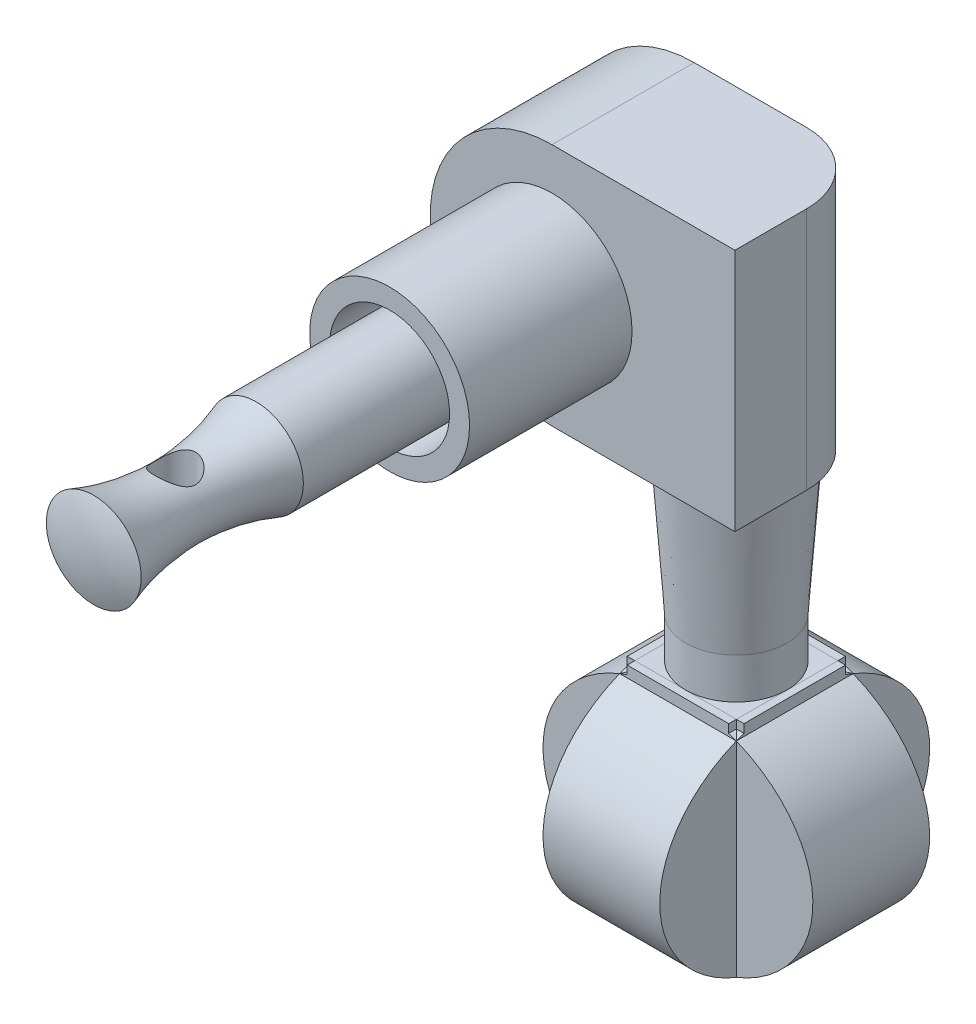
from build123d import *

# Parameters (mm, degrees)
MOVE_START             = 1.86
MOVE_FACE1_DEPTH       = 5.08
MOVE_FACE1_2_OUTLINE_R = 5.08
MOVE_FACE1_2_DEPTH     = 19.05
MOVE_FACE1_3_OUTLINE_R = 5.08
MOVE_FACE1_3_DEPTH     = 8.89
MOVE_START_2           = 19.05
MOVE_FACE1_4_OUTLINE_R = 2.95
MOVE_FACE1_4_DEPTH     = 19.05
MOVE_START_3           = 6.731
MOVE_FACE1_5_OUTLINE_R = 1.125
MOVE_FACE1_5_DEPTH     = 2.159
MOVE_START_4           = -7.62
MOVE_FACE1_6_OUTLINE_R = 1.27
MOVE_FACE1_6_DEPTH     = 15.24
MOVE_START_5           = -19.05
MOVE_FACE1_7_OUTLINE_R = 3.81
MOVE_FACE1_7_DEPTH     = 11.43
CUT_EXTRUDE2_START     = -8.3
SKETCH4_R              = 3.75
SKETCH4_R_2            = 2.95
CUT_EXTRUDE2_DEPTH     = 8.3
MOVE_FACE2_BY          = 0.08
SKETCH6_W              = 22.532040778
SKETCH6_H              = 17.162622236
CUT_EXTRUDE3_DEPTH     = 16.1
SKETCH7_W              = 16.875
SKETCH7_H              = 7.3
BOSS_EXTRUDE1_DEPTH    = 14.2
CUT_EXTRUDE4_DEPTH     = 14.2
MOVE_START_6           = 3.38
MOVE_FACE5_DEPTH       = 7.3
CUT_EXTRUDE5_REACH     = 50.258


with BuildPart() as part:
    # Move Face1: read off the stored shape, not the designer's step
    # Move Face1 outline → Move Face1 (new body)
    with BuildSketch(Plane.XY.offset(MOVE_START)):
        with BuildLine():
            ThreePointArc((-3.511, -31.99383827), (7.03, -34.29), (17.571, -31.99383827))
            Line((17.571, -31.99383827), (17.571, -22.753852444))
            Line((17.571, -22.753852444), (11.389315764, -19.05))
            Line((11.389315764, -19.05), (2.670684236, -19.05))
            Line((2.670684236, -19.05), (-3.511, -22.753852444))
            Line((-3.511, -22.753852444), (-3.511, -31.99383827))
        make_face()
        with BuildLine():
            Line((0, -7.62), (11.43, -7.62))
            Line((11.43, -7.62), (11.43, 7.62))
            Line((11.43, 7.62), (0, 7.62))
            ThreePointArc((0, 7.62), (-7.62, 0), (0, -7.62))
        make_face()
    extrude(amount=MOVE_FACE1_DEPTH)

    # Move Face1 2 outline → Move Face1 2 (add)
    with BuildSketch(Plane.XY):
        Circle(MOVE_FACE1_2_OUTLINE_R)
    extrude(amount=MOVE_FACE1_2_DEPTH)

    # Move Face1 3 outline → Move Face1 3 (add)
    with BuildSketch(Plane.XY):
        with BuildLine():
            ThreePointArc((0, 7.62), (-7.62, 0), (0, -7.62))
            Line((0, -7.62), (11.43, -7.62))
            Line((11.43, -7.62), (11.43, 7.62))
            Line((11.43, 7.62), (0, 7.62))
        make_face()
        Circle(MOVE_FACE1_3_OUTLINE_R, mode=Mode.SUBTRACT)
    extrude(amount=MOVE_FACE1_3_DEPTH)

    # Move Face1 4 outline → Move Face1 4 (add)
    with BuildSketch(Plane.XY.offset(MOVE_START_2)):
        Circle(MOVE_FACE1_4_OUTLINE_R)
    extrude(amount=MOVE_FACE1_4_DEPTH)

    # Move Face1 5 outline → Move Face1 5 (add)
    with BuildSketch(Plane.XY.offset(MOVE_START_3)):
        with BuildLine():
            Line((-10.24004056, 5.820733333), (-7.414650266, 1.75708891))
            ThreePointArc((-7.414650266, 1.75708891), (-5.388153673, 5.388153673), (-1.75708891, 7.414650266))
            Line((-1.75708891, 7.414650266), (-5.820733333, 10.24004056))
            ThreePointArc((-5.820733333, 10.24004056), (-9.878281733, 9.878281733), (-10.24004056, 5.820733333))
        make_face()
        with Locations((-7.633217703, 7.633217703)):
            Circle(MOVE_FACE1_5_OUTLINE_R, mode=Mode.SUBTRACT)
    extrude(amount=MOVE_FACE1_5_DEPTH)

    # Move Face1 6 outline → Move Face1 6 (cut)
    with BuildSketch(Plane(origin=(0, 0, 0), x_dir=(1, 0, 0), z_dir=(0, 1, 0)).offset(MOVE_START_4)):
        with BuildLine():
            ThreePointArc((7.03, 0), (10.141269837, -1.288730163), (11.43, -4.4))
            Line((11.43, -4.4), (11.43, 0))
            Line((11.43, 0), (7.03, 0))
        make_face()
        with Locations((0, -32.4485)):
            Circle(MOVE_FACE1_6_OUTLINE_R)
    extrude(amount=MOVE_FACE1_6_DEPTH, mode=Mode.SUBTRACT)

    # Move Face1 7 outline → Move Face1 7 (add)
    with BuildSketch(Plane(origin=(0, 0, 0), x_dir=(1, 0, 0), z_dir=(0, 1, 0)).offset(MOVE_START_5)):
        with Locations((7.03, -4.4)):
            Circle(MOVE_FACE1_7_OUTLINE_R)
    extrude(amount=MOVE_FACE1_7_DEPTH)

    # Move Face1 8 outline → Move Face1 8 (revolve, cut)
    with BuildSketch(Plane.XZ):
        with BuildLine():
            ThreePointArc((0, 38.1), (1.499969695, 37.962580669), (2.95, 37.554897859))
            Line((2.95, 37.554897859), (2.95, 38.1))
            Line((2.95, 38.1), (0, 38.1))
        make_face()
        with BuildLine():
            Line((2.95, 27.392283801), (2.95, 37.504716198))
            ThreePointArc((2.95, 37.504716198), (2.061, 32.448499999), (2.95, 27.392283801))
        make_face()
    revolve(axis=Axis((0, 0, 0), (0, 0, 1)), mode=Mode.SUBTRACT)

    # Move Face1 9 outline → Move Face1 9 (revolve)
    with BuildSketch(Plane.XZ):
        with BuildLine():
            ThreePointArc((2.95, 37.504716198), (2.958008721, 37.526732793), (2.96605223, 37.548736702))
            ThreePointArc((2.96605223, 37.548736702), (2.958027723, 37.551821458), (2.95, 37.554897859))
            Line((2.95, 37.554897859), (2.95, 37.504716198))
        make_face()
    revolve(axis=Axis((0, 0, 0), (0, 0, 1)))

    # Sketch4 → Cut-Extrude2 (cut)
    with BuildSketch(Plane.XY.offset(19.05).offset(CUT_EXTRUDE2_START)):
        Circle(SKETCH4_R)
        Circle(SKETCH4_R_2, mode=Mode.SUBTRACT)
    extrude(amount=CUT_EXTRUDE2_DEPTH, mode=Mode.SUBTRACT)

    # Sketch5 → Cut-Revolve1 (revolve, cut)
    with BuildSketch(Plane(origin=(0, 0, 4.4), x_dir=(-1, 0, 0), z_dir=(0, 0, -1))):
        Polygon((-3.22, -7.62), (-3.22, -19.05), (-3.855, -19.05), (-3.855, -16.51), align=None)
    revolve(axis=Axis((7.03, -7.62, 4.4), (0, -1, 0)), mode=Mode.SUBTRACT)

    # Move Face2: a curved face moved inward by 0.08
    add(Solid.thicken(part.faces().sort_by_distance((-5.08, 0, 13.97))[0], -MOVE_FACE2_BY), mode=Mode.SUBTRACT)

    # Sketch6 → Cut-Extrude3 (cut)
    with BuildSketch(Plane.XY):
        with Locations((7.03, -27.631311118)):
            Rectangle(SKETCH6_W, SKETCH6_H)
    extrude(amount=CUT_EXTRUDE3_DEPTH, mode=Mode.SUBTRACT)

    # Sketch7 → Boss-Extrude1 (add)
    with BuildSketch(Plane.XZ.offset(19.05)):
        with Locations((7.03, 4.4)):
            Rectangle(SKETCH7_W, SKETCH7_H)
    extrude(amount=BOSS_EXTRUDE1_DEPTH)

    # Sketch8 → Cut-Extrude4 (cut)
    with BuildSketch(Plane(origin=(0, 0, 0.75), x_dir=(-1, 0, 0), z_dir=(0, 0, -1))):
        with BuildLine():
            Line((-10.205, -19.571854416), (-10.205, -19.05))
            Line((-10.205, -19.05), (-15.4675, -19.05))
            Line((-15.4675, -19.05), (-15.4675, -26.15))
            add(Edge.make_bspline(
                [(-10.205, -19.571854416), (-15.4675, -21.370400141), (-15.4675, -26.15)],
                knots=[1.956591838, 1.956591838, 1.956591838, 3.141592654, 3.141592654, 3.141592654], degree=2, weights=[1, 0.829546954, 1]))
        make_face()
        with BuildLine():
            Line((1.4075, -19.05), (-3.855, -19.05))
            Line((-3.855, -19.05), (-3.855, -19.571854416))
            add(Edge.make_bspline(
                [(1.4075, -26.15), (1.4075, -21.370400141), (-3.855, -19.571854416)],
                knots=[0, 0, 0, 1.185000816, 1.185000816, 1.185000816], degree=2, weights=[1, 0.829546954, 1]))
            Line((1.4075, -26.15), (1.4075, -19.05))
        make_face()
        with BuildLine():
            add(Edge.make_bspline(
                [(-15.4675, -26.15), (-15.4675, -33.25), (-7.03, -33.25)],
                knots=[3.141592654, 3.141592654, 3.141592654, 4.71238898, 4.71238898, 4.71238898], degree=2, weights=[1, 0.707106781, 1]))
            Line((-15.4675, -26.15), (-15.4675, -33.25))
            Line((-15.4675, -33.25), (-7.03, -33.25))
        make_face()
        with BuildLine():
            Line((1.4075, -33.25), (1.4075, -26.15))
            add(Edge.make_bspline(
                [(-7.03, -33.25), (1.4075, -33.25), (1.4075, -26.15)],
                knots=[4.71238898, 4.71238898, 4.71238898, 6.283185307, 6.283185307, 6.283185307], degree=2, weights=[1, 0.707106781, 1]))
            Line((-7.03, -33.25), (1.4075, -33.25))
        make_face()
    extrude(amount=-CUT_EXTRUDE4_DEPTH, mode=Mode.SUBTRACT)

    # Move Face5: read off the stored shape, not the designer's step
    # Move Face5 outline → Move Face5 (add)
    with BuildSketch(Plane.YZ.offset(MOVE_START_6)):
        with BuildLine():
            Line((-32.551285538, 0.75), (-19.748714462, 0.75))
            add(Edge.make_bspline(
                [(-19.748714462, 0.75), (-19.654129969, 0.984263783), (-19.571854416, 1.225)],
                knots=[1.123429947, 1.123429947, 1.123429947, 1.185000816, 1.185000816, 1.185000816], degree=2, weights=[1, 0.999526166, 1]))
            Line((-19.571854416, 1.225), (-19.05, 1.225))
            Line((-19.05, 1.225), (-19.05, 7.575))
            Line((-19.05, 7.575), (-19.571854416, 7.575))
            add(Edge.make_bspline(
                [(-19.571854416, 7.575), (-19.654129969, 7.815736217), (-19.748714462, 8.05)],
                knots=[1.956591838, 1.956591838, 1.956591838, 2.018162706, 2.018162706, 2.018162706], degree=2, weights=[1, 0.999526166, 1]))
            Line((-19.748714462, 8.05), (-32.551285538, 8.05))
            add(Edge.make_bspline(
                [(-32.551285538, 8.05), (-34.02498069, 4.4), (-32.551285538, 0.75)],
                knots=[4.265022601, 4.265022601, 4.265022601, 5.15975536, 5.15975536, 5.15975536], degree=2, weights=[1, 0.901589512, 1]))
        make_face()
        with BuildLine():
            add(Edge.make_bspline(
                [(-32.551285538, 0.75), (-26.15, -15.104494863), (-19.748714462, 0.75)],
                knots=[5.15975536, 5.15975536, 5.15975536, 7.406615254, 7.406615254, 7.406615254], degree=2, weights=[1, 0.432592593, 1]))
            Line((-19.748714462, 0.75), (-32.551285538, 0.75))
        make_face()
        with BuildLine():
            add(Edge.make_bspline(
                [(-19.748714462, 8.05), (-26.15, 23.904494863), (-32.551285538, 8.05)],
                knots=[2.018162706, 2.018162706, 2.018162706, 4.265022601, 4.265022601, 4.265022601], degree=2, weights=[1, 0.432592593, 1]))
            Line((-32.551285538, 8.05), (-19.748714462, 8.05))
        make_face()
    extrude(amount=MOVE_FACE5_DEPTH)

    # Sketch10 → Cut-Extrude5 (cut, up to next)
    with BuildSketch(Plane(origin=(0, 0, 6.731), x_dir=(-1, 0, 0), z_dir=(0, 0, -1)), mode=Mode.PRIVATE) as cut_extrude5_sk1:
        with BuildLine():
            Line((5.820733333, 10.24004056), (1.75708891, 7.414650266))
            ThreePointArc((1.75708891, 7.414650266), (5.388153673, 5.388153673), (7.414650266, 1.75708891))
            Line((7.414650266, 1.75708891), (10.24004056, 5.820733333))
            ThreePointArc((10.24004056, 5.820733333), (9.878281733, 9.878281733), (5.820733333, 10.24004056))
        make_face()
    cut_extrude5_tool1 = extrude(cut_extrude5_sk1.sketch, amount=-CUT_EXTRUDE5_REACH, mode=Mode.PRIVATE) & part.part
    add(cut_extrude5_tool1.solids().sort_by_distance((-7.209511, 7.209511, 6.731))[0], mode=Mode.SUBTRACT)


solid = part.part
